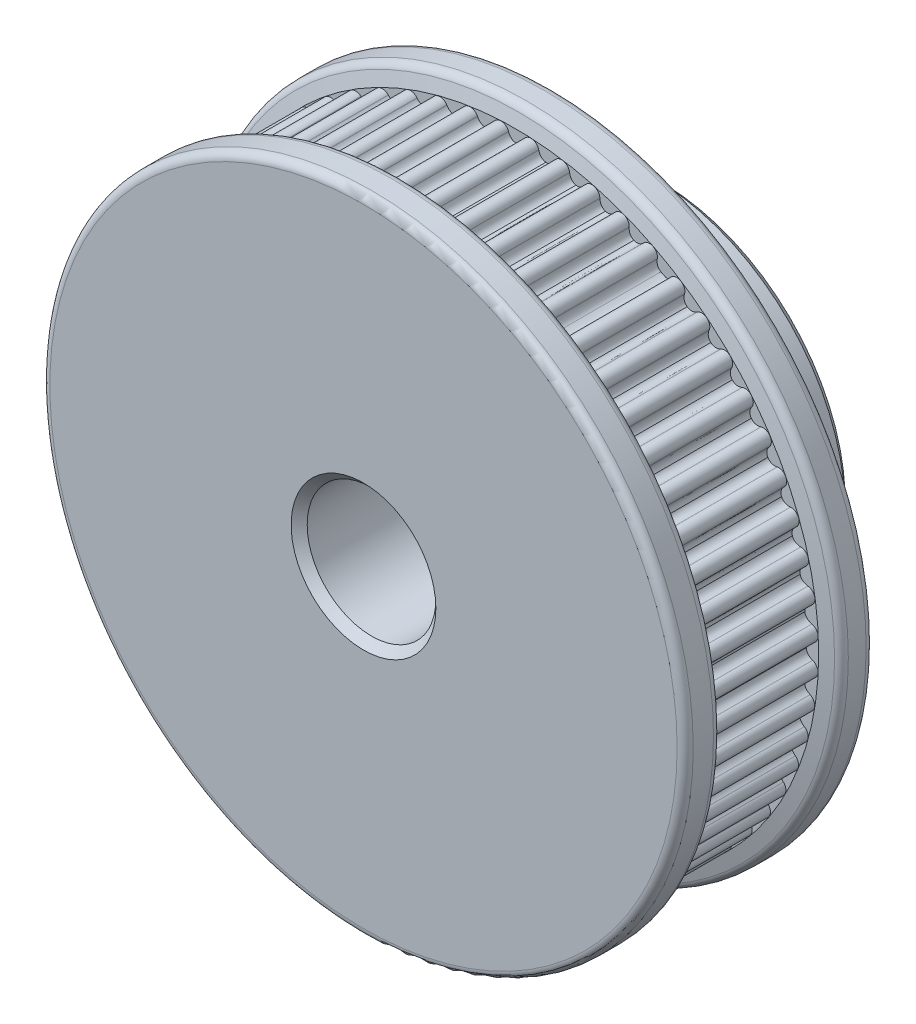
from build123d import *

# Parameters (mm, degrees)
SKETCH3_OUTSIDE_W       = 53.9
SKETCH3_OUTSIDE_H       = 53.9
CUT_EXTRUDE1_DEPTH      = 7
FILLET1_R               = 0.5
CHAMFER1_SIZE           = 1
CHAMFER2_SIZE           = 0.5
CUT_EXTRUDE2_REACH      = 35.771
CUT_EXTRUDE2_END_RADIUS = 12
SKETCH4_R               = 1.5
CIRPATTERN1_COUNT       = 2
CIRPATTERN1_ANGLE       = 90
CHAMFER3_SIZE           = 0.5
CUT_EXTRUDE3_DEPTH      = 2.5
CIRPATTERN2_COUNT       = 2
CIRPATTERN2_ANGLE       = 90


with BuildPart() as part:
    # Sketch1 → Revolve1 (revolve)
    with BuildSketch(Plane(origin=(0, 0, 0), x_dir=(0, 0, -1), z_dir=(1, 0, 0)), mode=Mode.PRIVATE) as revolve1_sk:
        Polygon((0, 4), (0, 12), (-7, 12), (-7, 18.314101615), (-6.548264889, 20), (-8.691858429, 20), (-9, 18.85), (-16, 18.85), (-16.308141571, 20), (-18.451735111, 20), (-18.451735111, 4), (-18, 4), align=None)
    revolve(revolve1_sk.sketch.rotate(Axis((0, 0, 0), (0, 0, 1)), 90), axis=Axis((0, 0, 0), (0, 0, 1)))

    # Sketch3 outside → Cut-Extrude1 (cut)
    with BuildSketch(Plane.XY.offset(9)):
        Rectangle(SKETCH3_OUTSIDE_W, SKETCH3_OUTSIDE_H)
        with BuildLine():
            Line((0.48954913, 18.480375333), (0.485818632, 18.469717385))
            add(Edge.make_bspline(
                [(0.485818632, 18.469717385), (0.407741985, 18.249527558), (0.24028179, 18.086154527), (0.026214695, 18.085070307)],
                knots=[0, 0, 0, 0, 1, 1, 1, 1], degree=3))
            add(Edge.make_bspline(
                [(0.026214695, 18.085070307), (-0.187846082, 18.086775093), (-0.354832577, 18.250628249), (-0.432269829, 18.471041123)],
                knots=[0, 0, 0, 0, 1, 1, 1, 1], degree=3))
            Line((-0.432269829, 18.471041123), (-0.435971787, 18.481716895))
            ThreePointArc((-0.435971787, 18.481716895), (-0.931215069, 18.811965966), (-1.391421689, 18.434420969))
            Line((-1.391421689, 18.434420969), (-1.394049444, 18.423439012))
            add(Edge.make_bspline(
                [(-1.394049444, 18.423439012), (-1.451513615, 18.187532894), (-1.598236067, 18.015569009), (-1.838247448, 17.991333228)],
                knots=[0, 0, 0, 0, 1, 1, 1, 1], degree=3))
            add(Edge.make_bspline(
                [(-1.838247448, 17.991333228), (-2.078200755, 17.966529071), (-2.256668862, 18.105266918), (-2.36065454, 18.324677051)],
                knots=[0, 0, 0, 0, 1, 1, 1, 1], degree=3))
            Line((-2.36065454, 18.324677051), (-2.365448953, 18.334900655))
            ThreePointArc((-2.365448953, 18.334900655), (-2.892499669, 18.611573568), (-3.310721031, 18.187992112))
            Line((-3.310721031, 18.187992112), (-3.312186463, 18.176795639))
            add(Edge.make_bspline(
                [(-3.312186463, 18.176795639), (-3.344676936, 17.936175198), (-3.472620506, 17.749816677), (-3.70878375, 17.700625641)],
                knots=[0, 0, 0, 0, 1, 1, 1, 1], degree=3))
            add(Edge.make_bspline(
                [(-3.70878375, 17.700625641), (-3.944829828, 17.650875413), (-4.136822322, 17.770198244), (-4.26317296, 17.977536961)],
                knots=[0, 0, 0, 0, 1, 1, 1, 1], degree=3))
            Line((-4.26317296, 17.977536961), (-4.269009766, 17.987203407))
            ThreePointArc((-4.269009766, 17.987203407), (-4.822093437, 18.207268875), (-5.19374742, 17.742291806))
            Line((-5.19374742, 17.742291806), (-5.194034475, 17.73100349))
            add(Edge.make_bspline(
                [(-5.194034475, 17.73100349), (-5.201195276, 17.488305014), (-5.308958188, 17.289593639), (-5.538685842, 17.215986296)],
                knots=[0, 0, 0, 0, 1, 1, 1, 1], degree=3))
            add(Edge.make_bspline(
                [(-5.538685842, 17.215986296), (-5.76823852, 17.141835071), (-5.971651891, 17.240435558), (-6.118983164, 17.433431215)],
                knots=[0, 0, 0, 0, 1, 1, 1, 1], degree=3))
            Line((-6.118983164, 17.433431215), (-6.125798415, 17.442434594))
            ThreePointArc((-6.125798415, 17.442434594), (-6.698855341, 17.603481534), (-7.019870025, 17.102203239))
            Line((-7.019870025, 17.102203239), (-7.018975557, 17.090946756))
            add(Edge.make_bspline(
                [(-7.018975557, 17.090946756), (-7.000728232, 16.848829299), (-7.087129813, 16.639942195), (-7.307904932, 16.542725002)],
                knots=[0, 0, 0, 0, 1, 1, 1, 1], degree=3))
            add(Edge.make_bspline(
                [(-7.307904932, 16.542725002), (-7.528449183, 16.444985197), (-7.741054792, 16.521783053), (-7.907752509, 16.698321148)],
                knots=[0, 0, 0, 0, 1, 1, 1, 1], degree=3))
            Line((-7.907752509, 16.698321148), (-7.915471534, 16.706562818))
            ThreePointArc((-7.915471534, 16.706562818), (-8.502223183, 16.806826766), (-8.769081466, 16.274739354))
            Line((-8.769081466, 16.274739354), (-8.767015275, 16.263638033))
            add(Edge.make_bspline(
                [(-8.767015275, 16.263638033), (-8.723559745, 16.024754286), (-8.787653361, 15.807980062), (-8.997057087, 15.688218151)],
                knots=[0, 0, 0, 0, 1, 1, 1, 1], degree=3))
            add(Edge.make_bspline(
                [(-8.997057087, 15.688218151), (-9.206176582, 15.567960623), (-9.425645077, 15.622114435), (-9.609882862, 15.78026078)],
                knots=[0, 0, 0, 0, 1, 1, 1, 1], degree=3))
            Line((-9.609882862, 15.78026078), (-9.61842109, 15.787650443))
            ThreePointArc((-9.61842109, 15.787650443), (-10.212438889, 15.826032887), (-10.422217015, 15.268966019))
            Line((-10.422217015, 15.268966019), (-10.419001739, 15.258141488))
            add(Edge.make_bspline(
                [(-10.419001739, 15.258141488), (-10.350814112, 15.025108711), (-10.391897539, 14.802822392), (-10.587635602, 14.6618279)],
                knots=[0, 0, 0, 0, 1, 1, 1, 1], degree=3))
            add(Edge.make_bspline(
                [(-10.587635602, 14.6618279), (-10.783039184, 14.520370216), (-11.006966022, 14.551286663), (-11.206725327, 14.689308572)],
                knots=[0, 0, 0, 0, 1, 1, 1, 1], degree=3))
            Line((-11.206725327, 14.689308572), (-11.215989213, 14.695765267))
            ThreePointArc((-11.215989213, 14.695765267), (-11.810764978, 14.671845679), (-11.961164573, 14.095902697))
            Line((-11.961164573, 14.095902697), (-11.956835439, 14.085473551))
            add(Edge.make_bspline(
                [(-11.956835439, 14.085473551), (-11.864662793, 13.8608449), (-11.882285914, 13.635481902), (-12.062213765, 13.474799593)],
                knots=[0, 0, 0, 0, 1, 1, 1, 1], degree=3))
            add(Edge.make_bspline(
                [(-12.062213765, 13.474799593), (-12.241760551, 13.313691593), (-12.467692344, 13.321031948), (-12.680784565, 13.437417226)],
                knots=[0, 0, 0, 0, 1, 1, 1, 1], degree=3))
            Line((-12.680784565, 13.437417226), (-12.69067261, 13.442870211))
            ThreePointArc((-12.69067261, 13.442870211), (-13.279689854, 13.356910661), (-13.36906311, 12.768401715))
            Line((-13.36906311, 12.768401715), (-13.363667548, 12.75848222))
            add(Edge.make_bspline(
                [(-13.363667548, 12.75848222), (-13.248519746, 12.544718773), (-13.242489477, 12.318748218), (-13.404635791, 12.140138563)],
                knots=[0, 0, 0, 0, 1, 1, 1, 1], degree=3))
            add(Edge.make_bspline(
                [(-13.404635791, 12.140138563), (-13.566358629, 11.961145379), (-13.791820019, 11.94482922), (-14.015910473, 12.038302725)],
                knots=[0, 0, 0, 0, 1, 1, 1, 1], degree=3))
            Line((-14.015910473, 12.038302725), (-14.026314343, 12.042692255))
            ThreePointArc((-14.026314343, 12.042692255), (-14.603119668, 11.895634533), (-14.630487393, 11.301007453))
            Line((-14.630487393, 11.301007453), (-14.624084519, 11.291706287))
            add(Edge.make_bspline(
                [(-14.624084519, 11.291706287), (-14.487223144, 11.091150081), (-14.457605555, 10.867047752), (-14.600193821, 10.672467633)],
                knots=[0, 0, 0, 0, 1, 1, 1, 1], degree=3))
            add(Edge.make_bspline(
                [(-14.600193821, 10.672467633), (-14.742320842, 10.477550354), (-14.964841628, 10.437756444), (-15.197475133, 10.50729406)],
                knots=[0, 0, 0, 0, 1, 1, 1, 1], degree=3))
            Line((-15.197475133, 10.50729406), (-15.20828084, 10.510572043))
            ThreePointArc((-15.20828084, 10.510572043), (-15.766554648, 10.304027345), (-15.731616994, 9.709796987))
            Line((-15.731616994, 9.709796987), (-15.72427696, 9.701216057))
            add(Edge.make_bspline(
                [(-15.72427696, 9.701216057), (-15.567201493, 9.516064428), (-15.514321081, 9.296285636), (-15.635789073, 9.087866916)],
                knots=[0, 0, 0, 0, 1, 1, 1, 1], degree=3))
            add(Edge.make_bspline(
                [(-15.635789073, 9.087866916), (-15.756763103, 8.879161094), (-15.973905301, 8.816325423), (-16.212533075, 8.861165283)],
                knots=[0, 0, 0, 0, 1, 1, 1, 1], degree=3))
            Line((-16.212533075, 8.861165283), (-16.22362223, 8.863295805))
            ThreePointArc((-16.22362223, 8.863295805), (-16.757247956, 8.599527076), (-16.660387708, 8.012203954))
            Line((-16.660387708, 8.012203954), (-16.652190932, 8.004437273))
            add(Edge.make_bspline(
                [(-16.652190932, 8.004437273), (-16.476622326, 7.836718782), (-16.401058458, 7.623671469), (-16.500075347, 7.403697626)],
                knots=[0, 0, 0, 0, 1, 1, 1, 1], degree=3))
            add(Edge.make_bspline(
                [(-16.500075347, 7.403697626), (-16.598570971, 7.183489887), (-16.807955525, 7.098300897), (-17.049963113, 7.117951724)],
                knots=[0, 0, 0, 0, 1, 1, 1, 1], degree=3))
            Line((-17.049963113, 7.117951724), (-17.06121422, 7.118911443))
            ThreePointArc((-17.06121422, 7.118911443), (-17.564345349, 6.80080859), (-17.406623728, 6.226827538))
            Line((-17.406623728, 6.226827538), (-17.397660015, 6.2199602))
            add(Edge.make_bspline(
                [(-17.397660015, 6.2199602), (-17.205521836, 6.071512405), (-17.108102407, 5.867530763), (-17.183583343, 5.638411876)],
                knots=[0, 0, 0, 0, 1, 1, 1, 1], degree=3))
            add(Edge.make_bspline(
                [(-17.183583343, 5.638411876), (-17.258521421, 5.409114862), (-17.45785427, 5.3025059), (-17.700590186, 5.296752397)],
                knots=[0, 0, 0, 0, 1, 1, 1, 1], degree=3))
            Line((-17.700590186, 5.296752397), (-17.711879977, 5.296530797))
            ThreePointArc((-17.711879977, 5.296530797), (-18.179004098, 4.927579021), (-17.962149135, 4.373228696))
            Line((-17.962149135, 4.373228696), (-17.952516694, 4.367335942))
            add(Edge.make_bspline(
                [(-17.952516694, 4.367335942), (-17.745914049, 4.239785268), (-17.627706406, 4.047104161), (-17.678824405, 3.811350505)],
                knots=[0, 0, 0, 0, 1, 1, 1, 1], degree=3))
            add(Edge.make_bspline(
                [(-17.678824405, 3.811350505), (-17.729383899, 3.575476442), (-17.916481111, 3.448615539), (-18.157285889, 3.417520742)],
                knots=[0, 0, 0, 0, 1, 1, 1, 1], degree=3))
            Line((-18.157285889, 3.417520742), (-18.16849067, 3.416120252))
            ThreePointArc((-18.16849067, 3.416120252), (-18.594489874, 3.000361866), (-18.320877478, 2.471715846))
            Line((-18.320877478, 2.471715846), (-18.310681844, 2.466862237))
            add(Edge.make_bspline(
                [(-18.310681844, 2.466862237), (-18.091878313, 2.361606156), (-17.954177565, 2.18233664), (-17.980372566, 1.942531181)],
                knots=[0, 0, 0, 0, 1, 1, 1, 1], degree=3))
            add(Edge.make_bspline(
                [(-17.980372566, 1.942531181), (-18.005999537, 1.702664355), (-18.178811236, 1.556941425), (-18.415046569, 1.500846015)],
                knots=[0, 0, 0, 0, 1, 1, 1, 1], degree=3))
            Line((-18.415046569, 1.500846015), (-18.426043577, 1.498281978))
            ThreePointArc((-18.426043577, 1.498281978), (-18.806250528, 1.040272118), (-18.478878453, 0.543122359))
            Line((-18.478878453, 0.543122359), (-18.468231332, 0.539361073))
            add(Edge.make_bspline(
                [(-18.468231332, 0.539361073), (-18.239624173, 0.457552792), (-18.083938997, 0.293658981), (-18.084924003, 0.052429079)],
                knots=[0, 0, 0, 0, 1, 1, 1, 1], degree=3))
            add(Edge.make_bspline(
                [(-18.084924003, 0.052429079), (-18.085337676, -0.18880248), (-18.2419705, -0.351790866), (-18.471048144, -0.432272296)],
                knots=[0, 0, 0, 0, 1, 1, 1, 1], degree=3))
            Line((-18.471048144, -0.432272296), (-18.481716895, -0.435971787))
            ThreePointArc((-18.481716895, -0.435971787), (-18.811965966, -0.931215069), (-18.434420969, -1.391421689))
            Line((-18.434420969, -1.391421689), (-18.423439012, -1.394049444))
            add(Edge.make_bspline(
                [(-18.423439012, -1.394049444), (-18.187532894, -1.451513615), (-18.015569009, -1.598236067), (-17.991333228, -1.838247448)],
                knots=[0, 0, 0, 0, 1, 1, 1, 1], degree=3))
            add(Edge.make_bspline(
                [(-17.991333228, -1.838247448), (-17.966529071, -2.078200755), (-18.105266918, -2.256668862), (-18.324677051, -2.36065454)],
                knots=[0, 0, 0, 0, 1, 1, 1, 1], degree=3))
            Line((-18.324677051, -2.36065454), (-18.334900655, -2.365448953))
            ThreePointArc((-18.334900655, -2.365448953), (-18.611573568, -2.892499669), (-18.187992112, -3.310721031))
            Line((-18.187992112, -3.310721031), (-18.176795639, -3.312186463))
            add(Edge.make_bspline(
                [(-18.176795639, -3.312186463), (-17.936175198, -3.344676936), (-17.749816677, -3.472620506), (-17.700625641, -3.70878375)],
                knots=[0, 0, 0, 0, 1, 1, 1, 1], degree=3))
            add(Edge.make_bspline(
                [(-17.700625641, -3.70878375), (-17.650875413, -3.944829828), (-17.770198244, -4.136822322), (-17.977536961, -4.26317296)],
                knots=[0, 0, 0, 0, 1, 1, 1, 1], degree=3))
            Line((-17.977536961, -4.26317296), (-17.987203407, -4.269009766))
            ThreePointArc((-17.987203407, -4.269009766), (-18.207268875, -4.822093437), (-17.742291806, -5.19374742))
            Line((-17.742291806, -5.19374742), (-17.73100349, -5.194034475))
            add(Edge.make_bspline(
                [(-17.73100349, -5.194034475), (-17.488305014, -5.201195276), (-17.289593639, -5.308958188), (-17.215986296, -5.538685842)],
                knots=[0, 0, 0, 0, 1, 1, 1, 1], degree=3))
            add(Edge.make_bspline(
                [(-17.215986296, -5.538685842), (-17.141835071, -5.76823852), (-17.240435558, -5.971651891), (-17.433431215, -6.118983164)],
                knots=[0, 0, 0, 0, 1, 1, 1, 1], degree=3))
            Line((-17.433431215, -6.118983164), (-17.442434594, -6.125798415))
            ThreePointArc((-17.442434594, -6.125798415), (-17.603481534, -6.698855341), (-17.102203239, -7.019870025))
            Line((-17.102203239, -7.019870025), (-17.090946756, -7.018975557))
            add(Edge.make_bspline(
                [(-17.090946756, -7.018975557), (-16.848829299, -7.000728232), (-16.639942195, -7.087129813), (-16.542725002, -7.307904932)],
                knots=[0, 0, 0, 0, 1, 1, 1, 1], degree=3))
            add(Edge.make_bspline(
                [(-16.542725002, -7.307904932), (-16.444985197, -7.528449183), (-16.521783053, -7.741054792), (-16.698321148, -7.907752509)],
                knots=[0, 0, 0, 0, 1, 1, 1, 1], degree=3))
            Line((-16.698321148, -7.907752509), (-16.706562818, -7.915471534))
            ThreePointArc((-16.706562818, -7.915471534), (-16.806826766, -8.502223183), (-16.274739354, -8.769081466))
            Line((-16.274739354, -8.769081466), (-16.263638033, -8.767015275))
            add(Edge.make_bspline(
                [(-16.263638033, -8.767015275), (-16.024754286, -8.723559745), (-15.807980062, -8.787653361), (-15.688218151, -8.997057087)],
                knots=[0, 0, 0, 0, 1, 1, 1, 1], degree=3))
            add(Edge.make_bspline(
                [(-15.688218151, -8.997057087), (-15.567960623, -9.206176582), (-15.622114435, -9.425645077), (-15.78026078, -9.609882862)],
                knots=[0, 0, 0, 0, 1, 1, 1, 1], degree=3))
            Line((-15.78026078, -9.609882862), (-15.787650443, -9.61842109))
            ThreePointArc((-15.787650443, -9.61842109), (-15.826032887, -10.212438889), (-15.268966019, -10.422217015))
            Line((-15.268966019, -10.422217015), (-15.258141488, -10.419001739))
            add(Edge.make_bspline(
                [(-15.258141488, -10.419001739), (-15.025108711, -10.350814112), (-14.802822392, -10.391897539), (-14.6618279, -10.587635602)],
                knots=[0, 0, 0, 0, 1, 1, 1, 1], degree=3))
            add(Edge.make_bspline(
                [(-14.6618279, -10.587635602), (-14.520370216, -10.783039184), (-14.551286663, -11.006966022), (-14.689308572, -11.206725327)],
                knots=[0, 0, 0, 0, 1, 1, 1, 1], degree=3))
            Line((-14.689308572, -11.206725327), (-14.695765267, -11.215989213))
            ThreePointArc((-14.695765267, -11.215989213), (-14.671845679, -11.810764978), (-14.095902697, -11.961164573))
            Line((-14.095902697, -11.961164573), (-14.085473551, -11.956835439))
            add(Edge.make_bspline(
                [(-14.085473551, -11.956835439), (-13.8608449, -11.864662793), (-13.635481902, -11.882285914), (-13.474799593, -12.062213765)],
                knots=[0, 0, 0, 0, 1, 1, 1, 1], degree=3))
            add(Edge.make_bspline(
                [(-13.474799593, -12.062213765), (-13.313691593, -12.241760551), (-13.321031948, -12.467692344), (-13.437417226, -12.680784565)],
                knots=[0, 0, 0, 0, 1, 1, 1, 1], degree=3))
            Line((-13.437417226, -12.680784565), (-13.442870211, -12.69067261))
            ThreePointArc((-13.442870211, -12.69067261), (-13.356910661, -13.279689854), (-12.768401715, -13.36906311))
            Line((-12.768401715, -13.36906311), (-12.75848222, -13.363667548))
            add(Edge.make_bspline(
                [(-12.75848222, -13.363667548), (-12.544718773, -13.248519746), (-12.318748218, -13.242489477), (-12.140138563, -13.404635791)],
                knots=[0, 0, 0, 0, 1, 1, 1, 1], degree=3))
            add(Edge.make_bspline(
                [(-12.140138563, -13.404635791), (-11.961145379, -13.566358629), (-11.94482922, -13.791820019), (-12.038302725, -14.015910473)],
                knots=[0, 0, 0, 0, 1, 1, 1, 1], degree=3))
            Line((-12.038302725, -14.015910473), (-12.042692255, -14.026314343))
            ThreePointArc((-12.042692255, -14.026314343), (-11.895634533, -14.603119668), (-11.301007453, -14.630487393))
            Line((-11.301007453, -14.630487393), (-11.291706287, -14.624084519))
            add(Edge.make_bspline(
                [(-11.291706287, -14.624084519), (-11.091150081, -14.487223144), (-10.867047752, -14.457605555), (-10.672467633, -14.600193821)],
                knots=[0, 0, 0, 0, 1, 1, 1, 1], degree=3))
            add(Edge.make_bspline(
                [(-10.672467633, -14.600193821), (-10.477550354, -14.742320842), (-10.437756444, -14.964841628), (-10.50729406, -15.197475133)],
                knots=[0, 0, 0, 0, 1, 1, 1, 1], degree=3))
            Line((-10.50729406, -15.197475133), (-10.510572043, -15.20828084))
            ThreePointArc((-10.510572043, -15.20828084), (-10.304027345, -15.766554648), (-9.709796987, -15.731616994))
            Line((-9.709796987, -15.731616994), (-9.701216057, -15.72427696))
            add(Edge.make_bspline(
                [(-9.701216057, -15.72427696), (-9.516064428, -15.567201493), (-9.296285636, -15.514321081), (-9.087866916, -15.635789073)],
                knots=[0, 0, 0, 0, 1, 1, 1, 1], degree=3))
            add(Edge.make_bspline(
                [(-9.087866916, -15.635789073), (-8.879161094, -15.756763103), (-8.816325423, -15.973905301), (-8.861165283, -16.212533075)],
                knots=[0, 0, 0, 0, 1, 1, 1, 1], degree=3))
            Line((-8.861165283, -16.212533075), (-8.863295805, -16.22362223))
            ThreePointArc((-8.863295805, -16.22362223), (-8.599527076, -16.757247956), (-8.012203954, -16.660387708))
            Line((-8.012203954, -16.660387708), (-8.004437273, -16.652190932))
            add(Edge.make_bspline(
                [(-8.004437273, -16.652190932), (-7.836718782, -16.476622326), (-7.623671469, -16.401058458), (-7.403697626, -16.500075347)],
                knots=[0, 0, 0, 0, 1, 1, 1, 1], degree=3))
            add(Edge.make_bspline(
                [(-7.403697626, -16.500075347), (-7.183489887, -16.598570971), (-7.098300897, -16.807955525), (-7.117951724, -17.049963113)],
                knots=[0, 0, 0, 0, 1, 1, 1, 1], degree=3))
            Line((-7.117951724, -17.049963113), (-7.118911443, -17.06121422))
            ThreePointArc((-7.118911443, -17.06121422), (-6.80080859, -17.564345349), (-6.226827538, -17.406623728))
            Line((-6.226827538, -17.406623728), (-6.2199602, -17.397660015))
            add(Edge.make_bspline(
                [(-6.2199602, -17.397660015), (-6.071512405, -17.205521836), (-5.867530763, -17.108102407), (-5.638411876, -17.183583343)],
                knots=[0, 0, 0, 0, 1, 1, 1, 1], degree=3))
            add(Edge.make_bspline(
                [(-5.638411876, -17.183583343), (-5.409114862, -17.258521421), (-5.3025059, -17.45785427), (-5.296752397, -17.700590186)],
                knots=[0, 0, 0, 0, 1, 1, 1, 1], degree=3))
            Line((-5.296752397, -17.700590186), (-5.296530797, -17.711879977))
            ThreePointArc((-5.296530797, -17.711879977), (-4.927579021, -18.179004098), (-4.373228696, -17.962149135))
            Line((-4.373228696, -17.962149135), (-4.367335942, -17.952516694))
            add(Edge.make_bspline(
                [(-4.367335942, -17.952516694), (-4.239785268, -17.745914049), (-4.047104161, -17.627706406), (-3.811350505, -17.678824405)],
                knots=[0, 0, 0, 0, 1, 1, 1, 1], degree=3))
            add(Edge.make_bspline(
                [(-3.811350505, -17.678824405), (-3.575476442, -17.729383899), (-3.448615539, -17.916481111), (-3.417520742, -18.157285889)],
                knots=[0, 0, 0, 0, 1, 1, 1, 1], degree=3))
            Line((-3.417520742, -18.157285889), (-3.416120252, -18.16849067))
            ThreePointArc((-3.416120252, -18.16849067), (-3.000361866, -18.594489874), (-2.471715846, -18.320877478))
            Line((-2.471715846, -18.320877478), (-2.466862237, -18.310681844))
            add(Edge.make_bspline(
                [(-2.466862237, -18.310681844), (-2.361606156, -18.091878313), (-2.18233664, -17.954177565), (-1.942531181, -17.980372566)],
                knots=[0, 0, 0, 0, 1, 1, 1, 1], degree=3))
            add(Edge.make_bspline(
                [(-1.942531181, -17.980372566), (-1.702664355, -18.005999537), (-1.556941425, -18.178811236), (-1.500846015, -18.415046569)],
                knots=[0, 0, 0, 0, 1, 1, 1, 1], degree=3))
            Line((-1.500846015, -18.415046569), (-1.498281978, -18.426043577))
            ThreePointArc((-1.498281978, -18.426043577), (-1.040272118, -18.806250528), (-0.543122359, -18.478878453))
            Line((-0.543122359, -18.478878453), (-0.539361073, -18.468231332))
            add(Edge.make_bspline(
                [(-0.539361073, -18.468231332), (-0.457552792, -18.239624173), (-0.293658981, -18.083938997), (-0.052429079, -18.084924003)],
                knots=[0, 0, 0, 0, 1, 1, 1, 1], degree=3))
            add(Edge.make_bspline(
                [(-0.052429079, -18.084924003), (0.18880248, -18.085337676), (0.351790866, -18.2419705), (0.432272296, -18.471048144)],
                knots=[0, 0, 0, 0, 1, 1, 1, 1], degree=3))
            Line((0.432272296, -18.471048144), (0.435971787, -18.481716895))
            ThreePointArc((0.435971787, -18.481716895), (0.931215069, -18.811965966), (1.391421689, -18.434420969))
            Line((1.391421689, -18.434420969), (1.39404954, -18.423439036))
            add(Edge.make_bspline(
                [(1.39404954, -18.423439036), (1.451513615, -18.187532894), (1.598236067, -18.015569009), (1.838247448, -17.991333228)],
                knots=[0, 0, 0, 0, 1, 1, 1, 1], degree=3))
            add(Edge.make_bspline(
                [(1.838247448, -17.991333228), (2.078200755, -17.966529071), (2.256668862, -18.105266919), (2.36065454, -18.324677051)],
                knots=[0, 0, 0, 0, 1, 1, 1, 1], degree=3))
            Line((2.36065454, -18.324677051), (2.365448953, -18.334900655))
            ThreePointArc((2.365448953, -18.334900655), (2.892499669, -18.611573568), (3.310721031, -18.187992112))
            Line((3.310721031, -18.187992112), (3.312186562, -18.176795653))
            add(Edge.make_bspline(
                [(3.312186562, -18.176795653), (3.344676936, -17.936175198), (3.472620506, -17.749816677), (3.70878375, -17.700625641)],
                knots=[0, 0, 0, 0, 1, 1, 1, 1], degree=3))
            add(Edge.make_bspline(
                [(3.70878375, -17.700625641), (3.944829828, -17.650875413), (4.136822322, -17.770198244), (4.26317296, -17.977536961)],
                knots=[0, 0, 0, 0, 1, 1, 1, 1], degree=3))
            Line((4.26317296, -17.977536961), (4.269009766, -17.987203407))
            ThreePointArc((4.269009766, -17.987203407), (4.822093437, -18.207268875), (5.19374742, -17.742291806))
            Line((5.19374742, -17.742291806), (5.194034574, -17.731003493))
            add(Edge.make_bspline(
                [(5.194034574, -17.731003493), (5.201195276, -17.488305013), (5.308958188, -17.289593639), (5.538685842, -17.215986296)],
                knots=[0, 0, 0, 0, 1, 1, 1, 1], degree=3))
            add(Edge.make_bspline(
                [(5.538685842, -17.215986296), (5.76823852, -17.141835071), (5.971651891, -17.240435558), (6.118983164, -17.433431215)],
                knots=[0, 0, 0, 0, 1, 1, 1, 1], degree=3))
            Line((6.118983164, -17.433431215), (6.125798415, -17.442434594))
            ThreePointArc((6.125798415, -17.442434594), (6.698855341, -17.603481534), (7.019870025, -17.102203239))
            Line((7.019870025, -17.102203239), (7.018975656, -17.090946748))
            add(Edge.make_bspline(
                [(7.018975656, -17.090946748), (7.000728232, -16.848829299), (7.087129813, -16.639942195), (7.307904932, -16.542725002)],
                knots=[0, 0, 0, 0, 1, 1, 1, 1], degree=3))
            add(Edge.make_bspline(
                [(7.307904932, -16.542725002), (7.528449183, -16.444985197), (7.741054792, -16.521783053), (7.907752509, -16.698321148)],
                knots=[0, 0, 0, 0, 1, 1, 1, 1], degree=3))
            Line((7.907752509, -16.698321148), (7.915471534, -16.706562818))
            ThreePointArc((7.915471534, -16.706562818), (8.502223183, -16.806826766), (8.769081466, -16.274739354))
            Line((8.769081466, -16.274739354), (8.767015373, -16.263638015))
            add(Edge.make_bspline(
                [(8.767015373, -16.263638015), (8.723559745, -16.024754286), (8.787653361, -15.807980062), (8.997057087, -15.688218151)],
                knots=[0, 0, 0, 0, 1, 1, 1, 1], degree=3))
            add(Edge.make_bspline(
                [(8.997057087, -15.688218151), (9.206176582, -15.567960623), (9.425645077, -15.622114435), (9.609882862, -15.78026078)],
                knots=[0, 0, 0, 0, 1, 1, 1, 1], degree=3))
            Line((9.609882862, -15.78026078), (9.61842109, -15.787650443))
            ThreePointArc((9.61842109, -15.787650443), (10.212438889, -15.826032887), (10.422217015, -15.268966019))
            Line((10.422217015, -15.268966019), (10.419001834, -15.25814146))
            add(Edge.make_bspline(
                [(10.419001834, -15.25814146), (10.350814112, -15.025108711), (10.391897539, -14.802822392), (10.587635602, -14.6618279)],
                knots=[0, 0, 0, 0, 1, 1, 1, 1], degree=3))
            add(Edge.make_bspline(
                [(10.587635602, -14.6618279), (10.783039184, -14.520370216), (11.006966022, -14.551286663), (11.206725327, -14.689308572)],
                knots=[0, 0, 0, 0, 1, 1, 1, 1], degree=3))
            Line((11.206725327, -14.689308572), (11.215989213, -14.695765267))
            ThreePointArc((11.215989213, -14.695765267), (11.810764978, -14.671845679), (11.961164573, -14.095902697))
            Line((11.961164573, -14.095902697), (11.956835531, -14.085473514))
            add(Edge.make_bspline(
                [(11.956835531, -14.085473514), (11.864662793, -13.8608449), (11.882285914, -13.635481902), (12.062213765, -13.474799593)],
                knots=[0, 0, 0, 0, 1, 1, 1, 1], degree=3))
            add(Edge.make_bspline(
                [(12.062213765, -13.474799593), (12.241760551, -13.313691593), (12.467692344, -13.321031948), (12.680784565, -13.437417226)],
                knots=[0, 0, 0, 0, 1, 1, 1, 1], degree=3))
            Line((12.680784565, -13.437417226), (12.69067261, -13.442870211))
            ThreePointArc((12.69067261, -13.442870211), (13.279689854, -13.356910661), (13.36906311, -12.768401715))
            Line((13.36906311, -12.768401715), (13.363667636, -12.758482173))
            add(Edge.make_bspline(
                [(13.363667636, -12.758482173), (13.248519746, -12.544718773), (13.242489477, -12.318748218), (13.404635791, -12.140138563)],
                knots=[0, 0, 0, 0, 1, 1, 1, 1], degree=3))
            add(Edge.make_bspline(
                [(13.404635791, -12.140138563), (13.566358629, -11.961145379), (13.791820019, -11.94482922), (14.015910473, -12.038302725)],
                knots=[0, 0, 0, 0, 1, 1, 1, 1], degree=3))
            Line((14.015910473, -12.038302725), (14.026314343, -12.042692255))
            ThreePointArc((14.026314343, -12.042692255), (14.603119668, -11.895634533), (14.630487393, -11.301007453))
            Line((14.630487393, -11.301007453), (14.624084601, -11.291706231))
            add(Edge.make_bspline(
                [(14.624084601, -11.291706231), (14.487223144, -11.091150081), (14.457605555, -10.867047752), (14.600193821, -10.672467633)],
                knots=[0, 0, 0, 0, 1, 1, 1, 1], degree=3))
            add(Edge.make_bspline(
                [(14.600193821, -10.672467633), (14.742320842, -10.477550354), (14.964841628, -10.437756444), (15.197475133, -10.50729406)],
                knots=[0, 0, 0, 0, 1, 1, 1, 1], degree=3))
            Line((15.197475133, -10.50729406), (15.20828084, -10.510572043))
            ThreePointArc((15.20828084, -10.510572043), (15.766554648, -10.304027345), (15.731616994, -9.709796987))
            Line((15.731616994, -9.709796987), (15.724277035, -9.701215992))
            add(Edge.make_bspline(
                [(15.724277035, -9.701215992), (15.567201493, -9.516064428), (15.514321081, -9.296285636), (15.635789073, -9.087866916)],
                knots=[0, 0, 0, 0, 1, 1, 1, 1], degree=3))
            add(Edge.make_bspline(
                [(15.635789073, -9.087866916), (15.756763103, -8.879161094), (15.973905301, -8.816325423), (16.212533075, -8.861165283)],
                knots=[0, 0, 0, 0, 1, 1, 1, 1], degree=3))
            Line((16.212533075, -8.861165283), (16.22362223, -8.863295805))
            ThreePointArc((16.22362223, -8.863295805), (16.757247956, -8.599527076), (16.660387708, -8.012203954))
            Line((16.660387708, -8.012203954), (16.652191, -8.004437202))
            add(Edge.make_bspline(
                [(16.652191, -8.004437202), (16.476622326, -7.836718782), (16.401058458, -7.623671469), (16.500075347, -7.403697626)],
                knots=[0, 0, 0, 0, 1, 1, 1, 1], degree=3))
            add(Edge.make_bspline(
                [(16.500075347, -7.403697626), (16.598570971, -7.183489887), (16.807955525, -7.098300897), (17.049963113, -7.117951724)],
                knots=[0, 0, 0, 0, 1, 1, 1, 1], degree=3))
            Line((17.049963113, -7.117951724), (17.06121422, -7.118911443))
            ThreePointArc((17.06121422, -7.118911443), (17.564345349, -6.80080859), (17.406623728, -6.226827538))
            Line((17.406623728, -6.226827538), (17.397660075, -6.219960122))
            add(Edge.make_bspline(
                [(17.397660075, -6.219960122), (17.205521836, -6.071512405), (17.108102407, -5.867530763), (17.183583343, -5.638411876)],
                knots=[0, 0, 0, 0, 1, 1, 1, 1], degree=3))
            add(Edge.make_bspline(
                [(17.183583343, -5.638411876), (17.258521421, -5.409114862), (17.45785427, -5.3025059), (17.700590186, -5.296752397)],
                knots=[0, 0, 0, 0, 1, 1, 1, 1], degree=3))
            Line((17.700590186, -5.296752397), (17.711879977, -5.296530797))
            ThreePointArc((17.711879977, -5.296530797), (18.179004098, -4.927579021), (17.962149135, -4.373228696))
            Line((17.962149135, -4.373228696), (17.952516746, -4.367335857))
            add(Edge.make_bspline(
                [(17.952516746, -4.367335857), (17.745914049, -4.239785268), (17.627706406, -4.047104161), (17.678824405, -3.811350505)],
                knots=[0, 0, 0, 0, 1, 1, 1, 1], degree=3))
            add(Edge.make_bspline(
                [(17.678824405, -3.811350505), (17.729383899, -3.575476442), (17.916481111, -3.448615539), (18.157285889, -3.417520742)],
                knots=[0, 0, 0, 0, 1, 1, 1, 1], degree=3))
            Line((18.157285889, -3.417520742), (18.16849067, -3.416120252))
            ThreePointArc((18.16849067, -3.416120252), (18.594489874, -3.000361866), (18.320877478, -2.471715846))
            Line((18.320877478, -2.471715846), (18.310681887, -2.466862147))
            add(Edge.make_bspline(
                [(18.310681887, -2.466862147), (18.091878313, -2.361606156), (17.954177565, -2.18233664), (17.980372566, -1.942531181)],
                knots=[0, 0, 0, 0, 1, 1, 1, 1], degree=3))
            add(Edge.make_bspline(
                [(17.980372566, -1.942531181), (18.005999537, -1.702664355), (18.178811236, -1.556941425), (18.415046569, -1.500846015)],
                knots=[0, 0, 0, 0, 1, 1, 1, 1], degree=3))
            Line((18.415046569, -1.500846015), (18.426043577, -1.498281978))
            ThreePointArc((18.426043577, -1.498281978), (18.806250528, -1.040272118), (18.478878453, -0.543122359))
            Line((18.478878453, -0.543122359), (18.468231365, -0.539360979))
            add(Edge.make_bspline(
                [(18.468231365, -0.539360979), (18.239624173, -0.457552792), (18.083938997, -0.293658981), (18.084924003, -0.052429079)],
                knots=[0, 0, 0, 0, 1, 1, 1, 1], degree=3))
            add(Edge.make_bspline(
                [(18.084924003, -0.052429079), (18.085337676, 0.18880248), (18.2419705, 0.351790866), (18.471048144, 0.432272296)],
                knots=[0, 0, 0, 0, 1, 1, 1, 1], degree=3))
            Line((18.471048144, 0.432272296), (18.481716895, 0.435971787))
            ThreePointArc((18.481716895, 0.435971787), (18.811965966, 0.931215069), (18.434420969, 1.391421689))
            Line((18.434420969, 1.391421689), (18.423439036, 1.39404954))
            add(Edge.make_bspline(
                [(18.423439036, 1.39404954), (18.187532894, 1.451513615), (18.015569009, 1.598236067), (17.991333228, 1.838247448)],
                knots=[0, 0, 0, 0, 1, 1, 1, 1], degree=3))
            add(Edge.make_bspline(
                [(17.991333228, 1.838247448), (17.966529071, 2.078200755), (18.105266919, 2.256668862), (18.324677051, 2.36065454)],
                knots=[0, 0, 0, 0, 1, 1, 1, 1], degree=3))
            Line((18.324677051, 2.36065454), (18.334900655, 2.365448953))
            ThreePointArc((18.334900655, 2.365448953), (18.611573568, 2.892499669), (18.187992112, 3.310721031))
            Line((18.187992112, 3.310721031), (18.176795653, 3.312186562))
            add(Edge.make_bspline(
                [(18.176795653, 3.312186562), (17.936175198, 3.344676936), (17.749816677, 3.472620506), (17.700625641, 3.70878375)],
                knots=[0, 0, 0, 0, 1, 1, 1, 1], degree=3))
            add(Edge.make_bspline(
                [(17.700625641, 3.70878375), (17.650875413, 3.944829828), (17.770198244, 4.136822322), (17.977536961, 4.26317296)],
                knots=[0, 0, 0, 0, 1, 1, 1, 1], degree=3))
            Line((17.977536961, 4.26317296), (17.987203407, 4.269009766))
            ThreePointArc((17.987203407, 4.269009766), (18.207268875, 4.822093437), (17.742291806, 5.19374742))
            Line((17.742291806, 5.19374742), (17.731003493, 5.194034574))
            add(Edge.make_bspline(
                [(17.731003493, 5.194034574), (17.488305013, 5.201195276), (17.289593639, 5.308958188), (17.215986296, 5.538685842)],
                knots=[0, 0, 0, 0, 1, 1, 1, 1], degree=3))
            add(Edge.make_bspline(
                [(17.215986296, 5.538685842), (17.141835071, 5.76823852), (17.240435558, 5.971651891), (17.433431215, 6.118983164)],
                knots=[0, 0, 0, 0, 1, 1, 1, 1], degree=3))
            Line((17.433431215, 6.118983164), (17.442434594, 6.125798415))
            ThreePointArc((17.442434594, 6.125798415), (17.603481534, 6.698855341), (17.102203239, 7.019870025))
            Line((17.102203239, 7.019870025), (17.090946748, 7.018975656))
            add(Edge.make_bspline(
                [(17.090946748, 7.018975656), (16.848829299, 7.000728232), (16.639942195, 7.087129813), (16.542725002, 7.307904932)],
                knots=[0, 0, 0, 0, 1, 1, 1, 1], degree=3))
            add(Edge.make_bspline(
                [(16.542725002, 7.307904932), (16.444985197, 7.528449183), (16.521783053, 7.741054792), (16.698321148, 7.907752509)],
                knots=[0, 0, 0, 0, 1, 1, 1, 1], degree=3))
            Line((16.698321148, 7.907752509), (16.706562818, 7.915471534))
            ThreePointArc((16.706562818, 7.915471534), (16.806826766, 8.502223183), (16.274739354, 8.769081466))
            Line((16.274739354, 8.769081466), (16.263638015, 8.767015373))
            add(Edge.make_bspline(
                [(16.263638015, 8.767015373), (16.024754286, 8.723559745), (15.807980062, 8.787653361), (15.688218151, 8.997057087)],
                knots=[0, 0, 0, 0, 1, 1, 1, 1], degree=3))
            add(Edge.make_bspline(
                [(15.688218151, 8.997057087), (15.567960623, 9.206176582), (15.622114435, 9.425645077), (15.78026078, 9.609882862)],
                knots=[0, 0, 0, 0, 1, 1, 1, 1], degree=3))
            Line((15.78026078, 9.609882862), (15.787650443, 9.61842109))
            ThreePointArc((15.787650443, 9.61842109), (15.826032887, 10.212438889), (15.268966019, 10.422217015))
            Line((15.268966019, 10.422217015), (15.25814146, 10.419001834))
            add(Edge.make_bspline(
                [(15.25814146, 10.419001834), (15.025108711, 10.350814112), (14.802822392, 10.391897539), (14.6618279, 10.587635602)],
                knots=[0, 0, 0, 0, 1, 1, 1, 1], degree=3))
            add(Edge.make_bspline(
                [(14.6618279, 10.587635602), (14.520370216, 10.783039184), (14.551286663, 11.006966022), (14.689308572, 11.206725327)],
                knots=[0, 0, 0, 0, 1, 1, 1, 1], degree=3))
            Line((14.689308572, 11.206725327), (14.695765267, 11.215989213))
            ThreePointArc((14.695765267, 11.215989213), (14.671845679, 11.810764978), (14.095902697, 11.961164573))
            Line((14.095902697, 11.961164573), (14.085473514, 11.956835531))
            add(Edge.make_bspline(
                [(14.085473514, 11.956835531), (13.8608449, 11.864662793), (13.635481902, 11.882285914), (13.474799593, 12.062213765)],
                knots=[0, 0, 0, 0, 1, 1, 1, 1], degree=3))
            add(Edge.make_bspline(
                [(13.474799593, 12.062213765), (13.313691593, 12.241760551), (13.321031948, 12.467692344), (13.437417226, 12.680784565)],
                knots=[0, 0, 0, 0, 1, 1, 1, 1], degree=3))
            Line((13.437417226, 12.680784565), (13.442870211, 12.69067261))
            ThreePointArc((13.442870211, 12.69067261), (13.356910661, 13.279689854), (12.768401715, 13.36906311))
            Line((12.768401715, 13.36906311), (12.758482173, 13.363667636))
            add(Edge.make_bspline(
                [(12.758482173, 13.363667636), (12.544718773, 13.248519746), (12.318748218, 13.242489477), (12.140138563, 13.404635791)],
                knots=[0, 0, 0, 0, 1, 1, 1, 1], degree=3))
            add(Edge.make_bspline(
                [(12.140138563, 13.404635791), (11.961145379, 13.566358629), (11.94482922, 13.791820019), (12.038302725, 14.015910473)],
                knots=[0, 0, 0, 0, 1, 1, 1, 1], degree=3))
            Line((12.038302725, 14.015910473), (12.042692255, 14.026314343))
            ThreePointArc((12.042692255, 14.026314343), (11.895634533, 14.603119668), (11.301007453, 14.630487393))
            Line((11.301007453, 14.630487393), (11.291706231, 14.624084601))
            add(Edge.make_bspline(
                [(11.291706231, 14.624084601), (11.091150081, 14.487223144), (10.867047752, 14.457605555), (10.672467633, 14.600193821)],
                knots=[0, 0, 0, 0, 1, 1, 1, 1], degree=3))
            add(Edge.make_bspline(
                [(10.672467633, 14.600193821), (10.477550354, 14.742320842), (10.437756444, 14.964841628), (10.50729406, 15.197475133)],
                knots=[0, 0, 0, 0, 1, 1, 1, 1], degree=3))
            Line((10.50729406, 15.197475133), (10.510572043, 15.20828084))
            ThreePointArc((10.510572043, 15.20828084), (10.304027345, 15.766554648), (9.709796987, 15.731616994))
            Line((9.709796987, 15.731616994), (9.701215992, 15.724277035))
            add(Edge.make_bspline(
                [(9.701215992, 15.724277035), (9.516064428, 15.567201493), (9.599334459, 15.33876957), (9.0425, 15.662069427)],
                knots=[0, 0, 0, 0, 1, 1, 1, 1], degree=3))
            add(Edge.make_bspline(
                [(9.0425, 15.662069427), (8.833444347, 15.782437904), (8.769979438, 15.999397026), (8.814127318, 16.23815379)],
                knots=[0, 0, 0, 0, 1, 1, 1, 1], degree=3))
            Line((8.814127318, 16.23815379), (8.816225683, 16.249249075))
            ThreePointArc((8.816225683, 16.249249075), (8.550911063, 16.782107883), (7.96387121, 16.683545371))
            Line((7.96387121, 16.683545371), (7.956128252, 16.675326181))
            add(Edge.make_bspline(
                [(7.956128252, 16.675326181), (7.788919518, 16.499272023), (7.576092163, 16.423090841), (7.35583219, 16.521469601)],
                knots=[0, 0, 0, 0, 1, 1, 1, 1], degree=3))
            add(Edge.make_bspline(
                [(7.35583219, 16.521469601), (7.135339834, 16.619326421), (7.049544188, 16.828463129), (7.068493344, 17.070526668)],
                knots=[0, 0, 0, 0, 1, 1, 1, 1], degree=3))
            Line((7.068493344, 17.070526668), (7.069420441, 17.081780511))
            ThreePointArc((7.069420441, 17.081780511), (6.74986033, 17.583987333), (6.176338931, 17.424602383))
            Line((6.176338931, 17.424602383), (6.169497529, 17.415618859))
            add(Edge.make_bspline(
                [(6.169497529, 17.415618859), (6.021607452, 17.223051072), (5.817909089, 17.125040702), (5.588572343, 17.199857097)],
                knots=[0, 0, 0, 0, 1, 1, 1, 1], degree=3))
            add(Edge.make_bspline(
                [(5.588572343, 17.199857097), (5.359059045, 17.274130119), (5.251872657, 17.473153068), (5.245415478, 17.715871284)],
                knots=[0, 0, 0, 0, 1, 1, 1, 1], degree=3))
            Line((5.245415478, 17.715871284), (5.24516115, 17.727160385))
            ThreePointArc((5.24516115, 17.727160385), (4.874856715, 18.193212938), (4.32113739, 17.974751805))
            Line((4.32113739, 17.974751805), (4.3152725, 17.965102373))
            add(Edge.make_bspline(
                [(4.3152725, 17.965102373), (4.188321395, 17.75813077), (3.995983787, 17.639365034), (3.760082928, 17.689799359)],
                knots=[0, 0, 0, 0, 1, 1, 1, 1], degree=3))
            add(Edge.make_bspline(
                [(3.760082928, 17.689799359), (3.524063283, 17.739674834), (3.396660511, 17.926403485), (3.364867742, 18.167117107)],
                knots=[0, 0, 0, 0, 1, 1, 1, 1], degree=3))
            Line((3.364867742, 18.167117107), (3.363434775, 18.17831778))
            ThreePointArc((3.363434775, 18.17831778), (2.946443149, 18.603109895), (2.418592563, 18.327966085))
            Line((2.418592563, 18.327966085), (2.413768442, 18.317756465))
            add(Edge.make_bspline(
                [(2.413768442, 18.317756465), (2.309147212, 18.09864867), (2.130277649, 17.960428791), (1.890397258, 17.985928478)],
                knots=[0, 0, 0, 0, 1, 1, 1, 1], degree=3))
            add(Edge.make_bspline(
                [(1.890397258, 17.985928478), (1.650457146, 18.010859958), (1.504233841, 18.183248475), (1.447453812, 18.419320192)],
                knots=[0, 0, 0, 0, 1, 1, 1, 1], degree=3))
            Line((1.447453812, 18.419320192), (1.444857905, 18.430309721))
            ThreePointArc((1.444857905, 18.430309721), (0.985747736, 18.809187287), (0.48954913, 18.480375333))
        make_face(mode=Mode.SUBTRACT)
    extrude(amount=CUT_EXTRUDE1_DEPTH, mode=Mode.SUBTRACT)

    # Fillet1
    fillet1_edges = [part.edges().sort_by_distance(p)[0] for p in [
        (20, 0, 8.691858429),
        (20, 0, 6.548264889),
        (20, 0, 18.451735111),
        (20, 0, 16.308141571),
    ]]
    fillet(fillet1_edges, radius=FILLET1_R)

    # Chamfer1
    chamfer1_edges = [part.edges().sort_by_distance(p)[0] for p in [
        (12, 0, 7),
    ]]
    chamfer(chamfer1_edges, length=CHAMFER1_SIZE)

    # Chamfer2
    chamfer2_edges = [part.edges().sort_by_distance(p)[0] for p in [
        (12, 0, 0),
    ]]
    chamfer(chamfer2_edges, length=CHAMFER2_SIZE)

    # Cut-Extrude2: up to this cylinder (the profile starts inside it)
    cut_extrude2_end = Plane(origin=(0, 0, 3.5), z_dir=(0, 0, -1)) * Cylinder(CUT_EXTRUDE2_END_RADIUS, 96.542, mode=Mode.PRIVATE)
    # Sketch4 → Cut-Extrude2 (cut, up to the surface)
    with BuildSketch(Plane(origin=(0, 0, 0), x_dir=(1, 0, 0), z_dir=(0, 1, 0)), mode=Mode.PRIVATE) as cut_extrude2_sk1:
        with Locations(Location((0, -3.5, 0), (0, 0, 270))):
            Circle(SKETCH4_R)
    cut_extrude2_tool1 = extrude(cut_extrude2_sk1.sketch, amount=-CUT_EXTRUDE2_REACH, mode=Mode.PRIVATE) & cut_extrude2_end
    cut_extrude2 = cut_extrude2_tool1.solids().sort_by_distance((0, 0, 3.5))[0]
    add(cut_extrude2, mode=Mode.SUBTRACT)

    # CirPattern1: Cut-Extrude2 ×2 about axis
    cirpattern1_axis = Axis((0, 0, 0), (0, 0, -1))
    for i in range(1, CIRPATTERN1_COUNT):
        add(cut_extrude2.rotate(cirpattern1_axis, i * CIRPATTERN1_ANGLE / (CIRPATTERN1_COUNT - 1)), mode=Mode.SUBTRACT)

    # Chamfer3
    chamfer3_edges = [part.edges().sort_by_distance(p)[0] for p in [
        (4, 0, 0),
        (4, 0, 18.451735111),
    ]]
    chamfer(chamfer3_edges, length=CHAMFER3_SIZE)

    # Sketch5 → Cut-Extrude3 (cut)
    with BuildSketch(Plane(origin=(0, -6, 0), x_dir=(1, 0, 0), z_dir=(0, 1, 0))):
        Polygon((-2.8, -1.883419246), (-2.8, 0), (2.8, 0), (2.8, -1.883419246), (2.8, -5.116580754), (0, -6.733161507), (-2.8, -5.116580754), align=None)
    cut_extrude3 = extrude(amount=-CUT_EXTRUDE3_DEPTH, mode=Mode.SUBTRACT)

    # CirPattern2: Cut-Extrude3 ×2 about axis
    cirpattern2_axis = Axis((0, 0, 0), (0, 0, -1))
    for i in range(1, CIRPATTERN2_COUNT):
        add(cut_extrude3.rotate(cirpattern2_axis, i * CIRPATTERN2_ANGLE / (CIRPATTERN2_COUNT - 1)), mode=Mode.SUBTRACT)


solid = part.part
